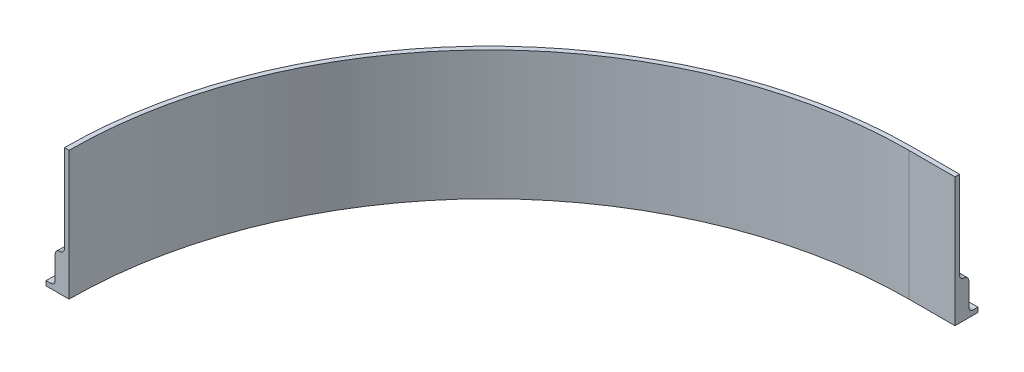
from build123d import *

# Parameters (mm, degrees)
BOTTOM_LEVEL_DEPTH = 5
MID_LEVEL_DEPTH    = 35
GUARD_RAIL_DEPTH   = 100
ROUNDING_R         = 5


with BuildPart() as part:
    # Sketch1 → Bottom level (new body)
    with BuildSketch(Plane(origin=(0, 0, 0), x_dir=(1, 0, 0), z_dir=(0, 1, 0))):
        with BuildLine():
            Line((481, 481), (531, 481))
            Line((531, 481), (531, 456))
            Line((531, 456), (481, 456))
            ThreePointArc((481, 456), (158.559307779, 322.440692221), (25, 0))
            Line((25, 0), (0, 0))
            ThreePointArc((0, 0), (140.881638249, 340.118361751), (481, 481))
        make_face()
    extrude(amount=BOTTOM_LEVEL_DEPTH)

    # Sketch2 → Mid level (add)
    with BuildSketch(Plane(origin=(0, 5, 0), x_dir=(1, 0, 0), z_dir=(0, 1, 0))):
        with BuildLine():
            Line((481, 456), (531, 456))
            Line((531, 456), (531, 471))
            Line((531, 471), (481, 471))
            ThreePointArc((481, 471), (147.952706061, 333.047293939), (10, 0))
            Line((10, 0), (25, 0))
            ThreePointArc((25, 0), (158.559307779, 322.440692221), (481, 456))
        make_face()
    extrude(amount=MID_LEVEL_DEPTH)

    # Sketch3 → Guard rail (add)
    with BuildSketch(Plane(origin=(0, 40, 0), x_dir=(1, 0, 0), z_dir=(0, 1, 0))):
        with BuildLine():
            Line((481, 456), (531, 456))
            Line((531, 456), (531, 461))
            Line((531, 461), (481, 461))
            ThreePointArc((481, 461), (155.023773873, 325.976226127), (20, 0))
            Line((20, 0), (25, 0))
            ThreePointArc((25, 0), (158.559307779, 322.440692221), (481, 456))
        make_face()
    extrude(amount=GUARD_RAIL_DEPTH)

    # Rounding
    rounding_edges = [part.edges().sort_by_distance(p)[0] for p in [
        (506, 40, -461),
        (506, 40, -471),
        (506, 5, -471),
        (155.023773873, 40, -325.976226127),
        (147.952706061, 40, -333.047293939),
        (147.952706061, 5, -333.047293939),
    ]]
    fillet(rounding_edges, radius=ROUNDING_R - 0.0001)  # a hair under: the kernel refuses the full size


solid = part.part
